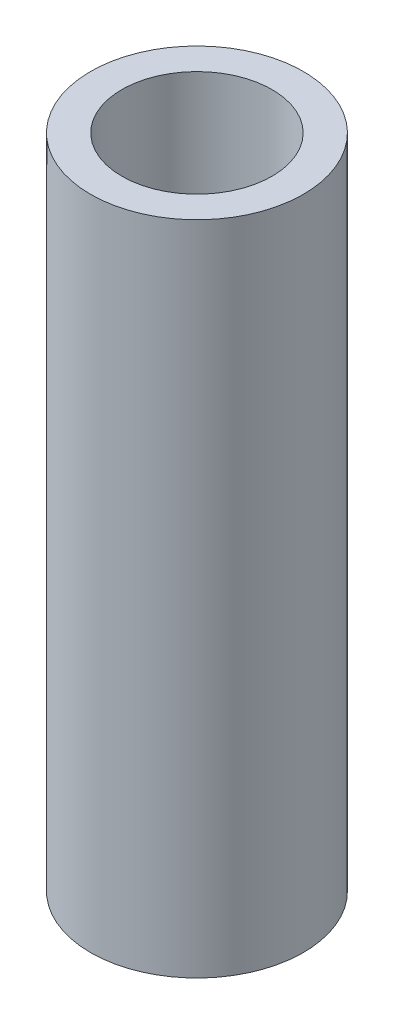
from build123d import *

# Parameters (mm, degrees)
SKETCH1_R           = 34
SKETCH1_R_2         = 24
BOSS_EXTRUDE1_DEPTH = 209.8
SKETCH2_R           = 12.53
CUT_EXTRUDE1_DEPTH  = 216.239494517


with BuildPart() as part:
    # Sketch1 → Boss-Extrude1 (new body)
    with BuildSketch(Plane(origin=(0, 0, 0), x_dir=(1, 0, 0), z_dir=(0, 1, 0))):
        Circle(SKETCH1_R)
        Circle(SKETCH1_R_2, mode=Mode.SUBTRACT)
    extrude(amount=BOSS_EXTRUDE1_DEPTH)

    # Sketch2 → Cut-Extrude1 (cut, through all)
    with BuildSketch(Plane(origin=(0, 0, 0), x_dir=(0, 0, -1), z_dir=(1, 0, 0))):
        with Locations((0, 145.6)):
            Circle(SKETCH2_R)
        with Locations((0, 87.6)):
            Circle(SKETCH2_R)
        with Locations((0, 29.6)):
            Circle(SKETCH2_R)
    extrude(amount=-CUT_EXTRUDE1_DEPTH, mode=Mode.SUBTRACT)


solid = part.part
